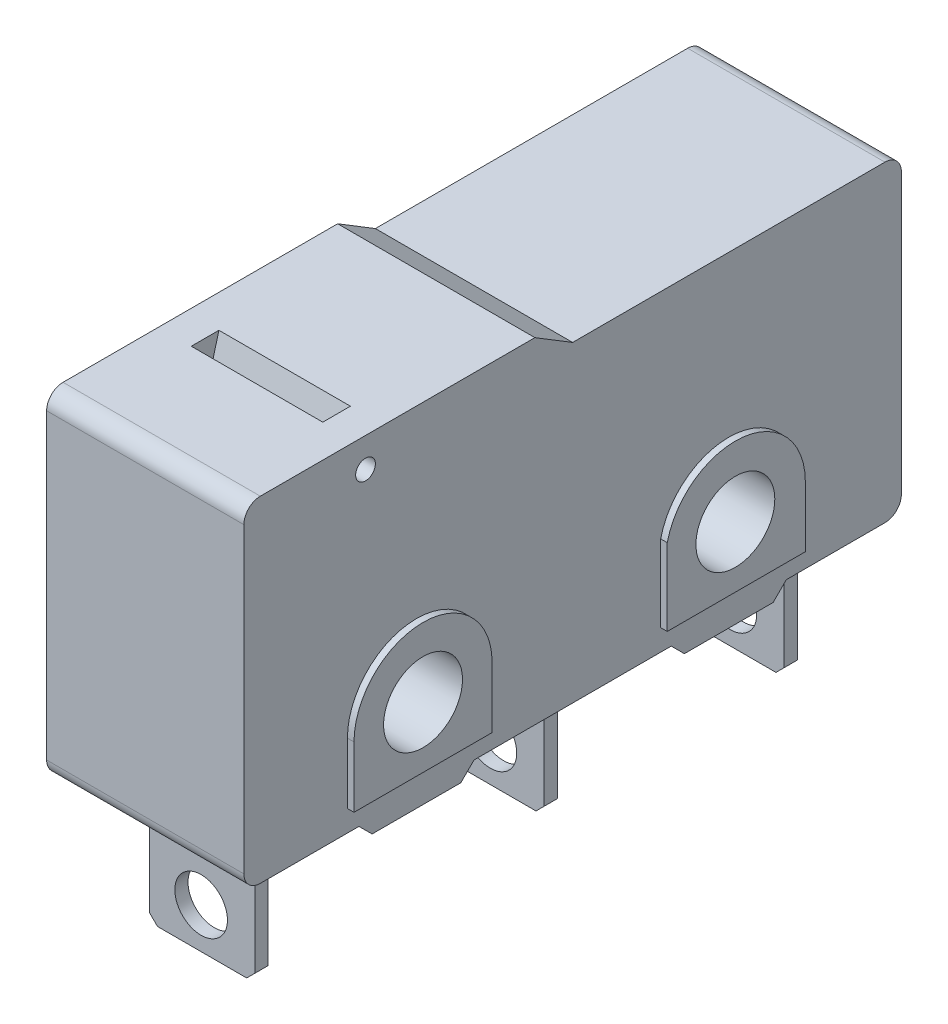
from build123d import *

# Parameters (mm, degrees)
BOSS_EXTRUDE1_DEPTH      = 3
SKETCH5_W                = 3.213765407
SKETCH5_H                = 0.4
BOSS_EXTRUDE2_DEPTH      = 3.9
CHAMFER2_SIZE            = 0.25
SKETCH6_R                = 0.8
CUT_EXTRUDE1_DEPTH       = 21.612860064
FILLET1_R                = 0.5
SKETCH7_R                = 1.2
CUT_EXTRUDE2_DEPTH       = 15.730919863
BOSS_EXTRUDE5_DEPTH      = 3.2
BOSS_EXTRUDE5_DEPTH_BACK = 3.4
SKETCH11_R               = 1.2
SKETCH12_R               = 0.3
CUT_EXTRUDE3_DEPTH       = 15.898322053
CUT_EXTRUDE4_DEPTH       = 2
CUT_EXTRUDE4_DEPTH_BACK  = 2


with BuildPart() as part:
    # Sketch1 → Boss-Extrude1 (new, symmetric)
    with BuildSketch(Plane(origin=(0, 0, 0), x_dir=(0, 0, -1), z_dir=(1, 0, 0))):
        Polygon((10, 4.4), (0, 4.4), (-1.147622848, 5.1), (-10, 5.1), (-10, -5.1), (-6.5, -5.1), (-6.1, -5.5), (-3.4, -5.5), (-3, -5.1), (3, -5.1), (3.4, -5.5), (6.1, -5.5), (6.5, -5.1), (10, -5.1), align=None)
    extrude(amount=BOSS_EXTRUDE1_DEPTH, both=True)

    # Sketch5 → Boss-Extrude2 (add)
    with BuildSketch(Plane.XZ.offset(5.1)):
        with Locations((0.02921605, 8.1)):
            Rectangle(SKETCH5_W, SKETCH5_H)
        with Locations((0.02921605, -0.7)):
            Rectangle(SKETCH5_W, SKETCH5_H)
        with Locations((0.02921605, -8)):
            Rectangle(SKETCH5_W, SKETCH5_H)
    extrude(amount=BOSS_EXTRUDE2_DEPTH)

    # Chamfer2
    chamfer2_edges = [part.edges().sort_by_distance(p)[0] for p in [
        (-1.577666654, -9, 8.1),
        (1.636098753, -9, -8),
        (-1.577666654, -9, -8),
        (1.636098753, -9, -0.7),
        (-1.577666654, -9, -0.7),
        (1.636098753, -9, 8.1),
    ]]
    chamfer(chamfer2_edges, length=CHAMFER2_SIZE)

    # Sketch6 → Cut-Extrude1 (cut, through all)
    with BuildSketch(Plane.XY.offset(8.3)):
        with Locations((0, -7.76874139)):
            Circle(SKETCH6_R)
    extrude(amount=-CUT_EXTRUDE1_DEPTH, mode=Mode.SUBTRACT)

    # Fillet1
    fillet1_edges = [part.edges().sort_by_distance(p)[0] for p in [
        (0, -5.1, -10),
        (0, 4.4, -10),
        (0, -5.1, 10),
        (0, 5.1, 10),
    ]]
    fillet(fillet1_edges, radius=FILLET1_R)

    # Sketch7 → Cut-Extrude2 (cut, through all)
    with BuildSketch(Plane(origin=(3, 0, 0), x_dir=(0, 0, -1), z_dir=(1, 0, 0))):
        with Locations((-4.75, -2.6)):
            Circle(SKETCH7_R)
        with Locations((4.75, -2.6)):
            Circle(SKETCH7_R)
    extrude(amount=-CUT_EXTRUDE2_DEPTH, mode=Mode.SUBTRACT)

    # Sketch11 → Boss-Extrude5 (add, two sides: drawn at the far end of the back side and taken through both)
    # profile 1 of 2: a face of its own
    with BuildSketch(Plane(origin=(0, 0, 0), x_dir=(0, 0, -1), z_dir=(1, 0, 0)).offset(-BOSS_EXTRUDE5_DEPTH_BACK)):
        with BuildLine():
            Line((-6.85, -4.453368072), (-2.65, -4.453368072))
            Line((-2.65, -4.453368072), (-2.65, -2.6))
            ThreePointArc((-2.65, -2.6), (-4.75, -0.5), (-6.85, -2.6))
            Line((-6.85, -2.6), (-6.85, -4.453368072))
        make_face()
        with Locations((-4.75, -2.6)):
            Circle(SKETCH11_R, mode=Mode.SUBTRACT)
    # profile 2 of 2: a face of its own
    with BuildSketch(Plane(origin=(0, 0, 0), x_dir=(0, 0, -1), z_dir=(1, 0, 0)).offset(-BOSS_EXTRUDE5_DEPTH_BACK)):
        with BuildLine():
            Line((2.678191921, -4.453368072), (6.878191921, -4.453368072))
            Line((6.878191921, -4.453368072), (6.878191921, -2.6))
            ThreePointArc((6.878191921, -2.6), (4.994944522, -0.485951033), (2.678191921, -2.113366526))
            Line((2.678191921, -2.113366526), (2.678191921, -4.453368072))
        make_face()
        with Locations((4.75, -2.6)):
            Circle(SKETCH11_R, mode=Mode.SUBTRACT)
    extrude(amount=BOSS_EXTRUDE5_DEPTH + BOSS_EXTRUDE5_DEPTH_BACK)

    # Sketch12 → Cut-Extrude3 (cut, through all)
    with BuildSketch(Plane(origin=(3, 0, 0), x_dir=(0, 0, -1), z_dir=(1, 0, 0))):
        with Locations((-6.3, 4.201970351)):
            Circle(SKETCH12_R)
    extrude(amount=-CUT_EXTRUDE3_DEPTH, mode=Mode.SUBTRACT)

    # Sketch13 → Cut-Extrude4 (cut, two sides: drawn at the far end of the back side and taken through both)
    with BuildSketch(Plane(origin=(0, 0, 0), x_dir=(0, 0, -1), z_dir=(1, 0, 0)).offset(-CUT_EXTRUDE4_DEPTH_BACK)):
        Polygon((-6.6, 4.201970351), (-6.6, 5.1), (-5.759373681, 5.1), (-6, 4.201970351), align=None)
    extrude(amount=CUT_EXTRUDE4_DEPTH + CUT_EXTRUDE4_DEPTH_BACK, mode=Mode.SUBTRACT)


solid = part.part
